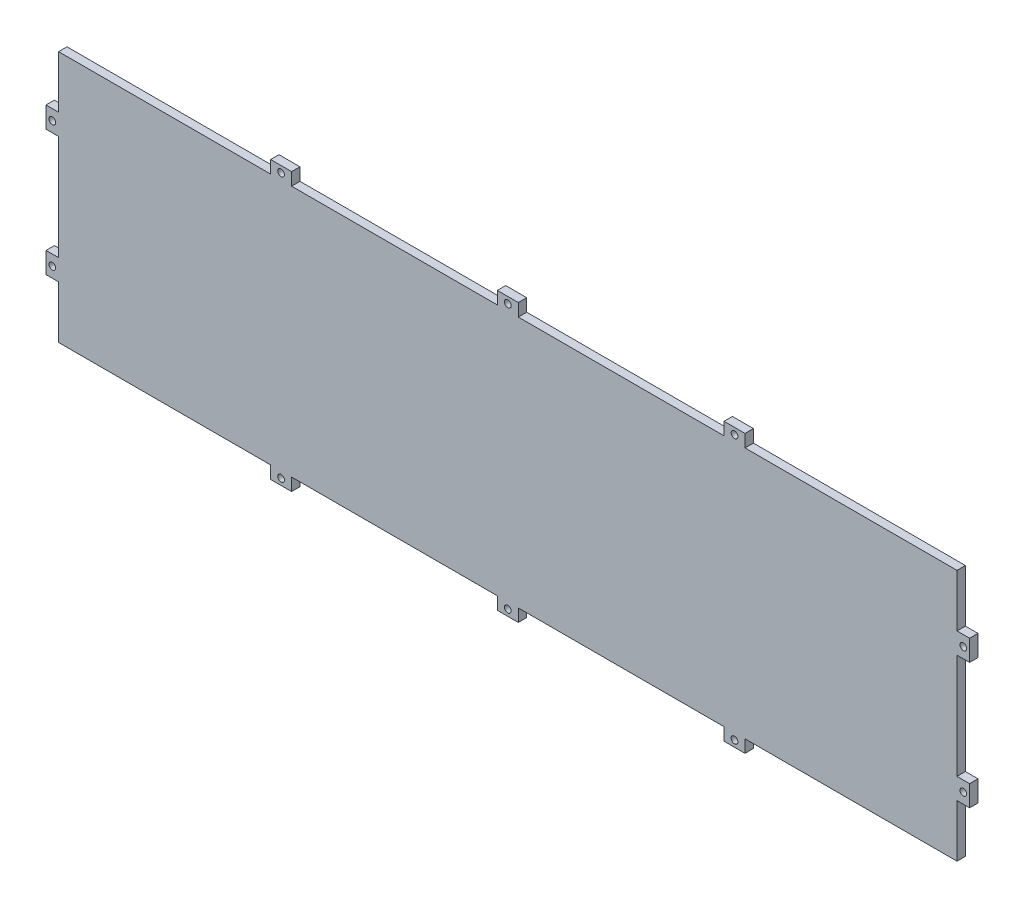
from build123d import *

# Parameters (mm, degrees)
SKETCH1_R           = 1.6
BOSS_EXTRUDE1_DEPTH = 4


with BuildPart() as part:
    # Sketch1 → Boss-Extrude1 (new body)
    with BuildSketch(Plane.XY):
        Polygon((6, 250), (107, 250), (107, 256), (117, 256), (117, 250), (215, 250), (215, 256), (225, 256), (225, 250), (323, 250), (323, 256), (333, 256), (333, 250), (434, 250), (434, 225), (440, 225), (440, 215), (434, 215), (434, 165), (440, 165), (440, 155), (434, 155), (434, 130), (333, 130), (333, 124), (323, 124), (323, 130), (225, 130), (225, 124), (215, 124), (215, 130), (117, 130), (117, 124), (107, 124), (107, 130), (6, 130), (6, 155), (0, 155), (0, 165), (6, 165), (6, 215), (0, 215), (0, 225), (6, 225), align=None)
        with Locations((112, 127)):
            Circle(SKETCH1_R, mode=Mode.SUBTRACT)
        with Locations((220, 127)):
            Circle(SKETCH1_R, mode=Mode.SUBTRACT)
        with Locations((328, 127)):
            Circle(SKETCH1_R, mode=Mode.SUBTRACT)
        with Locations((328, 253)):
            Circle(SKETCH1_R, mode=Mode.SUBTRACT)
        with Locations((220, 253)):
            Circle(SKETCH1_R, mode=Mode.SUBTRACT)
        with Locations((112, 253)):
            Circle(SKETCH1_R, mode=Mode.SUBTRACT)
        with Locations((3, 220)):
            Circle(SKETCH1_R, mode=Mode.SUBTRACT)
        with Locations((3, 160)):
            Circle(SKETCH1_R, mode=Mode.SUBTRACT)
        with Locations((437, 220)):
            Circle(SKETCH1_R, mode=Mode.SUBTRACT)
        with Locations((437, 160)):
            Circle(SKETCH1_R, mode=Mode.SUBTRACT)
    extrude(amount=-BOSS_EXTRUDE1_DEPTH)


solid = part.part
